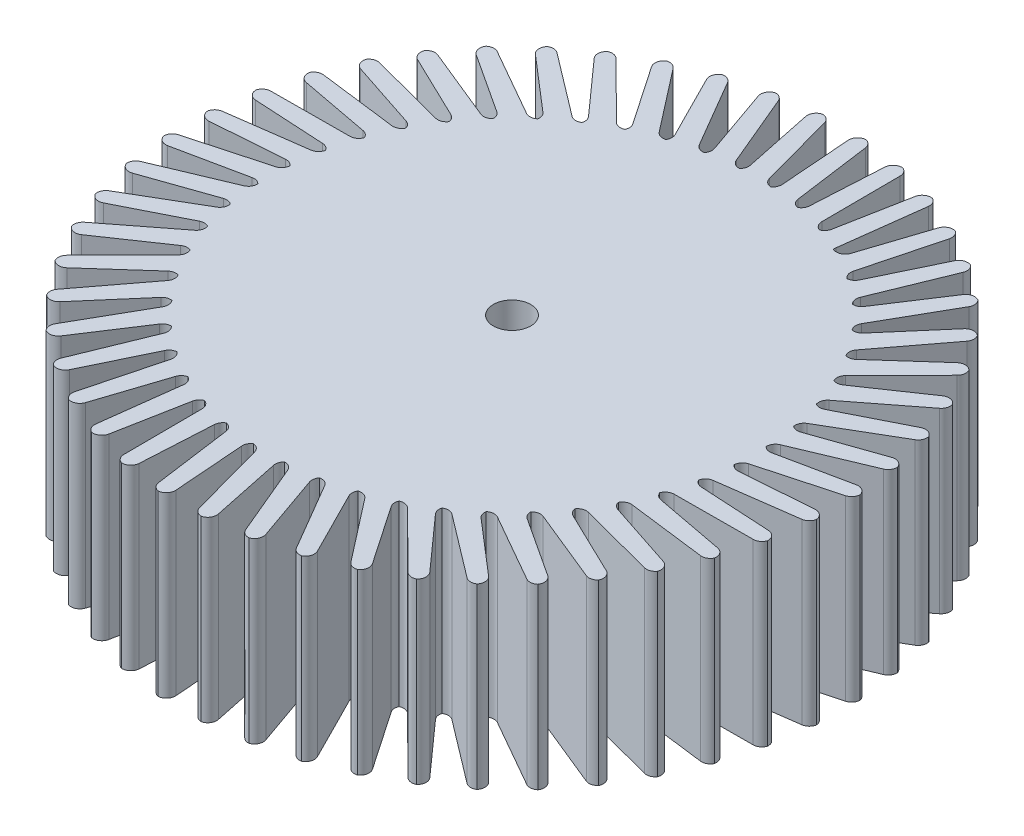
from build123d import *

# Parameters (mm, degrees)
SKETCH1_R           = 13.55
BOSS_EXTRUDE1_DEPTH = 10
SKETCH2_W           = 1
SKETCH2_H           = 8
BOSS_EXTRUDE2_DEPTH = 10
FILLET1_R           = 0.5
CIRPATTERN1_DEPTH   = 10


# Read off the part's stored shape, not the designer's step: CirPattern1
with BuildPart() as part:
    # Sketch1 → Boss-Extrude1 (new body)
    with BuildSketch(Plane(origin=(0, 0, 0), x_dir=(1, 0, 0), z_dir=(0, 1, 0))):
        with Locations(Location((0, 0, 0), (0, 0, 270))):
            Circle(SKETCH1_R)
    extrude(amount=BOSS_EXTRUDE1_DEPTH)

    # Sketch2 → Cut-Revolve1 (revolve, cut)
    with BuildSketch(Plane(origin=(0, 0, 0), x_dir=(0, 0, -1), z_dir=(1, 0, 0))):
        Polygon((0, 10), (0, 0), (0.05, 0), (0.05, 1), (0.05, 9), (0.05, 10), align=None)
        with BuildLine():
            ThreePointArc((1.05, 1), (0.757106781, 0.292893219), (0.05, 0))
            Line((0.05, 0), (1.05, 0))
            Line((1.05, 0), (1.05, 1))
        make_face()
        with BuildLine():
            Line((0.05, 1), (0.05, 0))
            ThreePointArc((0.05, 0), (0.757106781, 0.292893219), (1.05, 1))
            Line((1.05, 1), (0.05, 1))
        make_face()
        with BuildLine():
            ThreePointArc((1.05, 9), (0.757106781, 9.707106781), (0.05, 10))
            Line((0.05, 10), (0.05, 9))
            Line((0.05, 9), (1.05, 9))
        make_face()
        with BuildLine():
            Line((1.05, 10), (0.05, 10))
            ThreePointArc((0.05, 10), (0.757106781, 9.707106781), (1.05, 9))
            Line((1.05, 9), (1.05, 10))
        make_face()
        with Locations((0.55, 5)):
            Rectangle(SKETCH2_W, SKETCH2_H)
    revolve(axis=Axis((0, 0, 0), (0, 1, 0)), mode=Mode.SUBTRACT)

    # Sketch1<3> → Boss-Extrude2 (add)
    with BuildSketch(Plane(origin=(0, 0, 0), x_dir=(1, 0, 0), z_dir=(0, 1, 0))):
        with BuildLine():
            Line((8.666611372, 16.40098617), (6.330597525, 11.98023518))
            ThreePointArc((6.330597525, 11.98023518), (6.847142718, 11.692695865), (7.350653985, 11.382898839))
            Line((7.350653985, 11.382898839), (8.666611372, 16.40098617))
        make_face()
        Polygon((8.666611372, 16.40098617), (7.909290512, 16.779209591), (6.330597525, 11.98023518), align=None)
    extrude(amount=BOSS_EXTRUDE2_DEPTH)

    # Fillet1
    # the kernel refuses this fillet: 0.5 mm, written as the material it adds along each edge
    with BuildSketch(Plane(origin=(6.330597525, 0, -11.98023518), x_dir=(-0.8937672778939515, 0, -0.4485309944318632), z_dir=(0, 1, 0))) as fillet1_piece_1:
        with BuildLine():
            CenterArc((0.579649126, -0.499889719), FILLET1_R, 91.203401829, 97.236692762)
            Line((0.085064194, -0.573277353), (0, 0))
            ThreePointArc((0, 0), (0.284574118, -0.002988611), (0.569148236, 0))
        make_face()
    extrude(amount=10)
    with BuildSketch(Plane(origin=(7.350653985, 0, -11.382898839), x_dir=(0.8329727596859959, 0, 0.5533139991190319), z_dir=(0, 1, 0))) as fillet1_piece_2:
        with BuildLine():
            CenterArc((0.357318649, 0.499958096), FILLET1_R, 198.900147824, 70.358061506)
            Line((-0.115723612, 0.337998167), (0, 0))
            ThreePointArc((0, 0), (0.175422743, 0.001135588), (0.350845485, 0))
        make_face()
    extrude(amount=10)
    # the kernel refuses this fillet: 0.5 mm, written as the material it takes off along each edge
    with BuildSketch(Plane(origin=(7.909290512, -1.4463318, -16.779209591), x_dir=(0.8946335931706342, 0, 0.4468005527868112), z_dir=(0, 1, 0))) as fillet1_2_piece_1:
        with BuildLine():
            CenterArc((FILLET1_R * 1.15706544001, -FILLET1_R), FILLET1_R, 90, 98.329216797)
            Line((FILLET1_R * 0.167613391044, -FILLET1_R * 1.1448607704), (0, 0))
            Line((0, 0), (FILLET1_R * 1.15706544001, 0))
        make_face()
    extrude(amount=12.8926636, mode=Mode.SUBTRACT)
    with BuildSketch(Plane(origin=(8.666611372, -1.015049333, -16.40098617), x_dir=(-0.2536653920263894, 0, 0.967292028752485), z_dir=(0, 1, 0))) as fillet1_2_piece_2:
        with BuildLine():
            CenterArc((FILLET1_R * 0.812039466289, -FILLET1_R), FILLET1_R, 90, 78.155922469)
            Line((-FILLET1_R * 0.166670314419, -FILLET1_R * 0.794750967979), (0, 0))
            Line((0, 0), (FILLET1_R * 0.812039466289, 0))
        make_face()
    extrude(amount=12.030098666, mode=Mode.SUBTRACT)

    # CirPattern1 outline → CirPattern1 (add)
    with BuildSketch(Plane(origin=(0, 0, 0), x_dir=(1, 0, 0), z_dir=(0, 1, 0))):
        with BuildLine():
            ThreePointArc((9.03794035, 10.095451166), (8.884228267, 10.355633201), (8.908490317, 10.656853136))
            Line((8.908490317, 10.656853136), (10.579850738, 14.753517273))
            ThreePointArc((10.579850738, 14.753517273), (10.604246197, 15.05415706), (10.451286802, 15.314124064))
            ThreePointArc((10.451286802, 15.314124064), (10.067730955, 15.337620789), (9.780780476, 15.082030087))
            Line((9.780780476, 15.082030087), (8.041287678, 11.469144544))
            ThreePointArc((8.041287678, 11.469144544), (7.878548966, 11.277157004), (7.642898718, 11.188771121))
            ThreePointArc((7.642898718, 11.188771121), (8.358315329, 10.664945611), (9.03794035, 10.095451166))
        make_face()
        with BuildLine():
            ThreePointArc((4.798854406, 13.159581319), (4.691350912, 12.932015718), (4.486606202, 12.785650738))
            ThreePointArc((4.486606202, 12.785650738), (5.161593376, 12.528385922), (5.821911455, 12.235515805))
            ThreePointArc((5.821911455, 12.235515805), (5.815229867, 12.307746604), (5.819070114, 12.380184056))
            Line((5.819070114, 12.380184056), (6.400859814, 16.989070228))
            ThreePointArc((6.400859814, 16.989070228), (6.346612715, 17.285779971), (6.131580873, 17.49730001))
            ThreePointArc((6.131580873, 17.49730001), (5.755012974, 17.420724546), (5.543991837, 17.099574637))
            Line((5.543991837, 17.099574637), (4.798854406, 13.159581319))
        make_face()
        with BuildLine():
            ThreePointArc((3.0401295, 13.673375469), (2.963248986, 13.433724701), (2.779360358, 13.261887347))
            ThreePointArc((2.779360358, 13.261887347), (3.640778466, 13.051713763), (4.486606202, 12.785650738))
            ThreePointArc((4.486606202, 12.785650738), (4.2450274, 12.967204528), (4.152170733, 13.254780145))
            Line((4.152170733, 13.254780145), (4.128580925, 17.679206235))
            ThreePointArc((4.128580925, 17.679206235), (4.036069524, 17.966296918), (3.795268404, 18.147940087))
            ThreePointArc((3.795268404, 18.147940087), (3.4319172, 18.022867762), (3.264619853, 17.676921549))
            Line((3.264619853, 17.676921549), (3.0401295, 13.673375469))
        make_face()
        with BuildLine():
            ThreePointArc((1.229387136, 13.953214374), (1.184445047, 13.705578931), (1.024558888, 13.511209387))
            ThreePointArc((1.024558888, 13.511209387), (1.906040602, 13.415271492), (2.779360358, 13.261887347))
            ThreePointArc((2.779360358, 13.261887347), (2.516150771, 13.410355558), (2.386552355, 13.683350699))
            Line((2.386552355, 13.683350699), (1.785660871, 18.066846122))
            ThreePointArc((1.785660871, 18.066846122), (1.656468065, 18.339405544), (1.394017841, 18.488063877))
            ThreePointArc((1.394017841, 18.488063877), (1.050100371, 18.316634714), (0.929389317, 17.951811433))
            Line((0.929389317, 17.951811433), (1.229387136, 13.953214374))
        make_face()
        with BuildLine():
            ThreePointArc((-0.602390383, 13.994309912), (-0.614625075, 13.742926905), (-0.747773069, 13.529350887))
            ThreePointArc((-0.747773069, 13.529350887), (0.138689855, 13.549290207), (1.024558888, 13.511209386))
            ThreePointArc((1.024558888, 13.511209386), (0.744222106, 13.624051687), (0.580099406, 13.877795328))
            Line((0.580099406, 13.877795328), (-0.587812335, 18.145357263))
            ThreePointArc((-0.587812335, 18.145357263), (-0.751476023, 18.398721856), (-1.031084754, 18.511851768))
            ThreePointArc((-1.031084754, 18.511851768), (-1.349683967, 18.296998968), (-1.421743327, 17.919540847))
            Line((-1.421743327, 17.919540847), (-0.602390383, 13.994309912))
        make_face()
        with BuildLine():
            ThreePointArc((-2.423860835, 13.795958928), (-2.403178791, 13.54512959), (-2.507310422, 13.316001444))
            ThreePointArc((-2.507310422, 13.316001444), (-1.631033914, 13.451476809), (-0.747773069, 13.529350887))
            ThreePointArc((-0.747773069, 13.529350887), (-1.040440407, 13.604636513), (-1.236279206, 13.834787032))
            Line((-1.236279206, 13.834787032), (-2.951227909, 17.913396311))
            ThreePointArc((-2.951227909, 17.913396311), (-3.146562147, 18.143230937), (-3.438545203, 18.218896743))
            ThreePointArc((-3.438545203, 18.218896743), (-3.726374838, 17.964296496), (-3.748549549, 17.580661948))
            Line((-3.748549549, 17.580661948), (-2.423860835, 13.795958928))
        make_face()
        with BuildLine():
            ThreePointArc((-4.203858356, 13.361555262), (-4.150613451, 13.115571352), (-4.223946997, 12.874811523))
            ThreePointArc((-4.223946997, 12.874811523), (-3.372850241, 13.123504914), (-2.507310422, 13.316001443))
            ThreePointArc((-2.507310422, 13.316001443), (-2.807300696, 13.352442237), (-3.031504737, 13.555061694))
            Line((-3.031504737, 13.555061694), (-5.264147155, 17.374932181))
            ThreePointArc((-5.264147155, 17.374932181), (-5.48780972, 17.577304305), (-5.787171191, 17.614211344))
            ThreePointArc((-5.787171191, 17.614211344), (-6.039306402, 17.324219931), (-6.011217048, 16.940973049))
            Line((-6.011217048, 16.940973049), (-4.203858356, 13.361555262))
        make_face()
        with BuildLine():
            ThreePointArc((-5.911926696, 12.69853168), (-5.827029965, 12.461602051), (-5.868310669, 12.213330008))
            ThreePointArc((-5.868310669, 12.213330008), (-5.056956164, 12.570986211), (-4.223946997, 12.874811522))
            ThreePointArc((-4.223946997, 12.874811522), (-4.526127291, 12.871783973), (-4.774860382, 13.043405492))
            Line((-4.774860382, 13.043405492), (-7.486995384, 16.539178144))
            ThreePointArc((-7.486995384, 16.539178144), (-7.735159348, 16.710625124), (-8.036777075, 16.708141904))
            ThreePointArc((-8.036777075, 16.708141904), (-8.248903759, 16.387721159), (-8.171030958, 16.011419404))
            Line((-8.171030958, 16.011419404), (-5.911926696, 12.69853168))
        make_face()
        with BuildLine():
            ThreePointArc((-7.51884033, 11.818232701), (-7.403744381, 11.594411285), (-7.412265918, 11.342875031))
            ThreePointArc((-7.412265918, 11.342875031), (-6.654536166, 11.803374449), (-5.868310669, 12.213330007))
            ThreePointArc((-5.868310669, 12.213330007), (-6.167510594, 12.170885916), (-6.436516842, 12.308573006))
            Line((-6.436516842, 12.308573006), (-9.581739046, 15.420434183))
            ThreePointArc((-9.581739046, 15.420434183), (-9.850158254, 15.558022514), (-10.148871475, 15.516191525))
            ThreePointArc((-10.148871475, 15.516191525), (-10.317360086, 15.170823935), (-10.191036262, 14.807905934))
            Line((-10.191036262, 14.807905934), (-7.51884033, 11.818232701))
        make_face()
        with BuildLine():
            ThreePointArc((-8.997104522, 10.735720484), (-8.853778677, 10.528836927), (-8.829395242, 10.278340316))
            ThreePointArc((-8.829395242, 10.278340316), (-8.138255208, 10.833803678), (-7.412265917, 11.34287503))
            ThreePointArc((-7.412265917, 11.34287503), (-7.70336608, 11.261740626), (-7.988042714, 11.363137423))
            Line((-7.988042714, 11.363137423), (-11.512536497, 14.037842318))
            ThreePointArc((-11.512536497, 14.037842318), (-11.796618222, 14.139217825), (-12.08731587, 14.058754807))
            ThreePointArc((-12.08731587, 14.058754807), (-12.209283522, 13.694349708), (-12.036670111, 13.351025088))
            Line((-12.036670111, 13.351025088), (-8.997104522, 10.735720484))
        make_face()
        with BuildLine():
            ThreePointArc((-10.321425761, 9.469517113), (-10.152322366, 9.28311125), (-10.095451166, 9.03794035))
            ThreePointArc((-10.095451166, 9.03794035), (-9.482726448, 9.678863522), (-8.829395241, 10.278340315))
            ThreePointArc((-8.829395241, 10.278340315), (-9.107414837, 10.159903832), (-9.402890961, 10.223275408))
            Line((-9.402890961, 10.223275408), (-13.246351256, 12.41505908))
            ThreePointArc((-13.246351256, 12.41505908), (-13.541234781, 12.478487198), (-13.818942939, 12.360768896))
            ThreePointArc((-13.818942939, 12.360768896), (-13.892302731, 11.98356136), (-13.676353196, 11.665704501))
            Line((-13.676353196, 11.665704501), (-10.321425761, 9.469517113))
        make_face()
        with BuildLine():
            ThreePointArc((-11.469144544, 8.041287678), (-11.277157004, 7.878548966), (-11.188771121, 7.642898718))
            ThreePointArc((-11.188771121, 7.642898718), (-10.664945609, 8.358315327), (-10.095451164, 9.037940349))
            ThreePointArc((-10.095451164, 9.037940349), (-10.355633201, 8.884228267), (-10.656853136, 8.908490317))
            Line((-10.656853136, 8.908490317), (-14.753517273, 10.579850738))
            ThreePointArc((-14.753517273, 10.579850738), (-15.05415706, 10.604246197), (-15.314124064, 10.451286802))
            ThreePointArc((-15.314124064, 10.451286802), (-15.337620789, 10.067730955), (-15.082030087, 9.780780476))
            Line((-15.082030087, 9.780780476), (-11.469144544, 8.041287678))
        make_face()
        with BuildLine():
            ThreePointArc((-12.420623084, 6.475469582), (-12.20903636, 6.339182524), (-12.0906481, 6.117084969))
            ThreePointArc((-12.0906481, 6.117084969), (-11.664684594, 6.89475404), (-11.188771119, 7.642898717))
            ThreePointArc((-11.188771119, 7.642898717), (-11.426663811, 7.456541093), (-11.7284736, 7.441278486))
            Line((-11.7284736, 7.441278486), (-16.008246518, 8.563618217))
            ThreePointArc((-16.008246518, 8.563618217), (-16.309498536, 8.548563602), (-16.547276279, 8.362980293))
            ThreePointArc((-16.547276279, 8.362980293), (-16.520507902, 7.979638881), (-16.229649261, 7.728504585))
            Line((-16.229649261, 7.728504585), (-12.420623084, 6.475469582))
        make_face()
        with BuildLine():
            ThreePointArc((-13.159581319, 4.798854406), (-12.932015718, 4.691350912), (-12.785650738, 4.486606202))
            ThreePointArc((-12.785650738, 4.486606202), (-12.464837592, 5.3132216), (-12.090648099, 6.117084968))
            ThreePointArc((-12.090648099, 6.117084968), (-12.302181033, 5.901270433), (-12.599416628, 5.846744318))
            Line((-12.599416628, 5.846744318), (-16.989070228, 6.400859814))
            ThreePointArc((-16.989070228, 6.400859814), (-17.285779971, 6.346612715), (-17.49730001, 6.131580873))
            ThreePointArc((-17.49730001, 6.131580873), (-17.420724546, 5.755012974), (-17.099574637, 5.543991837))
            Line((-17.099574637, 5.543991837), (-13.159581319, 4.798854406))
        make_face()
        with BuildLine():
            ThreePointArc((-13.673375469, 3.0401295), (-13.433724701, 2.963248986), (-13.261887347, 2.779360358))
            ThreePointArc((-13.261887347, 2.779360358), (-13.051713762, 3.640778466), (-12.785650736, 4.486606201))
            ThreePointArc((-12.785650736, 4.486606201), (-12.967204528, 4.2450274), (-13.254780145, 4.152170733))
            Line((-13.254780145, 4.152170733), (-17.679206235, 4.128580925))
            ThreePointArc((-17.679206235, 4.128580925), (-17.966296918, 4.036069524), (-18.147940087, 3.795268404))
            ThreePointArc((-18.147940087, 3.795268404), (-18.022867762, 3.4319172), (-17.676921549, 3.264619853))
            Line((-17.676921549, 3.264619853), (-13.673375469, 3.0401295))
        make_face()
        with BuildLine():
            ThreePointArc((-13.953214374, 1.229387136), (-13.705578931, 1.184445047), (-13.511209387, 1.024558888))
            ThreePointArc((-13.511209387, 1.024558888), (-13.415271491, 1.906040602), (-13.261887345, 2.779360358))
            ThreePointArc((-13.261887345, 2.779360358), (-13.410355558, 2.516150771), (-13.683350699, 2.386552355))
            Line((-13.683350699, 2.386552355), (-18.066846122, 1.785660871))
            ThreePointArc((-18.066846122, 1.785660871), (-18.339405544, 1.656468065), (-18.488063877, 1.394017841))
            ThreePointArc((-18.488063877, 1.394017841), (-18.316634714, 1.050100371), (-17.951811433, 0.929389317))
            Line((-17.951811433, 0.929389317), (-13.953214374, 1.229387136))
        make_face()
        with BuildLine():
            ThreePointArc((-13.994309912, -0.602390383), (-13.742926905, -0.614625075), (-13.529350887, -0.747773069))
            ThreePointArc((-13.529350887, -0.747773069), (-13.549290206, 0.138689855), (-13.511209385, 1.024558888))
            ThreePointArc((-13.511209385, 1.024558888), (-13.624051687, 0.744222106), (-13.877795328, 0.580099406))
            Line((-13.877795328, 0.580099406), (-18.145357263, -0.587812335))
            ThreePointArc((-18.145357263, -0.587812335), (-18.398721856, -0.751476023), (-18.511851768, -1.031084754))
            ThreePointArc((-18.511851768, -1.031084754), (-18.296998968, -1.349683967), (-17.919540847, -1.421743327))
            Line((-17.919540847, -1.421743327), (-13.994309912, -0.602390383))
        make_face()
        with BuildLine():
            ThreePointArc((-13.795958928, -2.423860835), (-13.54512959, -2.403178791), (-13.316001444, -2.507310422))
            ThreePointArc((-13.316001444, -2.507310422), (-13.451476809, -1.631033914), (-13.529350886, -0.747773069))
            ThreePointArc((-13.529350886, -0.747773069), (-13.604636513, -1.040440407), (-13.834787032, -1.236279206))
            Line((-13.834787032, -1.236279206), (-17.913396311, -2.951227909))
            ThreePointArc((-17.913396311, -2.951227909), (-18.143230937, -3.146562147), (-18.218896743, -3.438545203))
            ThreePointArc((-18.218896743, -3.438545203), (-17.964296496, -3.726374838), (-17.580661948, -3.748549549))
            Line((-17.580661948, -3.748549549), (-13.795958928, -2.423860835))
        make_face()
        with BuildLine():
            ThreePointArc((-13.361555262, -4.203858356), (-13.115571352, -4.150613451), (-12.874811523, -4.223946997))
            ThreePointArc((-12.874811523, -4.223946997), (-13.123504914, -3.37285024), (-13.316001442, -2.507310422))
            ThreePointArc((-13.316001442, -2.507310422), (-13.352442237, -2.807300696), (-13.555061694, -3.031504737))
            Line((-13.555061694, -3.031504737), (-17.374932181, -5.264147155))
            ThreePointArc((-17.374932181, -5.264147155), (-17.577304305, -5.48780972), (-17.614211344, -5.787171191))
            ThreePointArc((-17.614211344, -5.787171191), (-17.324219931, -6.039306402), (-16.940973049, -6.011217048))
            Line((-16.940973049, -6.011217048), (-13.361555262, -4.203858356))
        make_face()
        with BuildLine():
            ThreePointArc((-12.69853168, -5.911926696), (-12.461602051, -5.827029965), (-12.213330008, -5.868310669))
            ThreePointArc((-12.213330008, -5.868310669), (-12.570986211, -5.056956164), (-12.874811522, -4.223946997))
            ThreePointArc((-12.874811522, -4.223946997), (-12.871783973, -4.526127291), (-13.043405492, -4.774860382))
            Line((-13.043405492, -4.774860382), (-16.539178144, -7.486995384))
            ThreePointArc((-16.539178144, -7.486995384), (-16.710625124, -7.735159348), (-16.708141904, -8.036777075))
            ThreePointArc((-16.708141904, -8.036777075), (-16.387721159, -8.248903759), (-16.011419404, -8.171030958))
            Line((-16.011419404, -8.171030958), (-12.69853168, -5.911926696))
        make_face()
        with BuildLine():
            ThreePointArc((-11.818232701, -7.51884033), (-11.594411285, -7.403744381), (-11.342875031, -7.412265918))
            ThreePointArc((-11.342875031, -7.412265918), (-11.803374449, -6.654536166), (-12.213330007, -5.868310669))
            ThreePointArc((-12.213330007, -5.868310669), (-12.170885916, -6.167510594), (-12.308573006, -6.436516842))
            Line((-12.308573006, -6.436516842), (-15.420434183, -9.581739046))
            ThreePointArc((-15.420434183, -9.581739046), (-15.558022514, -9.850158254), (-15.516191525, -10.148871475))
            ThreePointArc((-15.516191525, -10.148871475), (-15.170823935, -10.317360086), (-14.807905934, -10.191036262))
            Line((-14.807905934, -10.191036262), (-11.818232701, -7.51884033))
        make_face()
        with BuildLine():
            ThreePointArc((-10.735720484, -8.997104522), (-10.528836927, -8.853778677), (-10.278340316, -8.829395242))
            ThreePointArc((-10.278340316, -8.829395242), (-10.833803678, -8.138255209), (-11.34287503, -7.412265917))
            ThreePointArc((-11.34287503, -7.412265917), (-11.261740626, -7.70336608), (-11.363137423, -7.988042714))
            Line((-11.363137423, -7.988042714), (-14.037842318, -11.512536497))
            ThreePointArc((-14.037842318, -11.512536497), (-14.139217825, -11.796618222), (-14.058754807, -12.08731587))
            ThreePointArc((-14.058754807, -12.08731587), (-13.694349708, -12.209283522), (-13.351025088, -12.036670111))
            Line((-13.351025088, -12.036670111), (-10.735720484, -8.997104522))
        make_face()
        with BuildLine():
            ThreePointArc((-9.469517113, -10.321425761), (-9.28311125, -10.152322366), (-9.03794035, -10.095451166))
            ThreePointArc((-9.03794035, -10.095451166), (-9.678863522, -9.482726449), (-10.278340316, -8.829395242))
            ThreePointArc((-10.278340316, -8.829395242), (-10.159903832, -9.107414837), (-10.223275408, -9.402890961))
            Line((-10.223275408, -9.402890961), (-12.41505908, -13.246351256))
            ThreePointArc((-12.41505908, -13.246351256), (-12.478487198, -13.541234781), (-12.360768896, -13.818942939))
            ThreePointArc((-12.360768896, -13.818942939), (-11.98356136, -13.892302731), (-11.665704501, -13.676353196))
            Line((-11.665704501, -13.676353196), (-9.469517113, -10.321425761))
        make_face()
        with BuildLine():
            ThreePointArc((-8.041287678, -11.469144544), (-7.878548966, -11.277157004), (-7.642898718, -11.188771121))
            ThreePointArc((-7.642898718, -11.188771121), (-8.358315328, -10.66494561), (-9.037940349, -10.095451165))
            ThreePointArc((-9.037940349, -10.095451165), (-8.884228267, -10.355633201), (-8.908490317, -10.656853136))
            Line((-8.908490317, -10.656853136), (-10.579850738, -14.753517273))
            ThreePointArc((-10.579850738, -14.753517273), (-10.604246197, -15.05415706), (-10.451286802, -15.314124064))
            ThreePointArc((-10.451286802, -15.314124064), (-10.067730955, -15.337620789), (-9.780780476, -15.082030087))
            Line((-9.780780476, -15.082030087), (-8.041287678, -11.469144544))
        make_face()
        with BuildLine():
            ThreePointArc((-6.475469582, -12.420623084), (-6.339182524, -12.20903636), (-6.117084969, -12.0906481))
            ThreePointArc((-6.117084969, -12.0906481), (-6.894754041, -11.664684595), (-7.642898718, -11.18877112))
            ThreePointArc((-7.642898718, -11.18877112), (-7.456541093, -11.426663811), (-7.441278486, -11.7284736))
            Line((-7.441278486, -11.7284736), (-8.563618217, -16.008246518))
            ThreePointArc((-8.563618217, -16.008246518), (-8.548563602, -16.309498536), (-8.362980293, -16.547276279))
            ThreePointArc((-8.362980293, -16.547276279), (-7.979638881, -16.520507902), (-7.728504585, -16.229649261))
            Line((-7.728504585, -16.229649261), (-6.475469582, -12.420623084))
        make_face()
        with BuildLine():
            ThreePointArc((-4.798854406, -13.159581319), (-4.691350912, -12.932015718), (-4.486606202, -12.785650738))
            ThreePointArc((-4.486606202, -12.785650738), (-5.313221601, -12.464837593), (-6.117084969, -12.0906481))
            ThreePointArc((-6.117084969, -12.0906481), (-5.901270433, -12.302181033), (-5.846744318, -12.599416628))
            Line((-5.846744318, -12.599416628), (-6.400859814, -16.989070228))
            ThreePointArc((-6.400859814, -16.989070228), (-6.346612715, -17.285779971), (-6.131580873, -17.49730001))
            ThreePointArc((-6.131580873, -17.49730001), (-5.755012974, -17.420724546), (-5.543991837, -17.099574637))
            Line((-5.543991837, -17.099574637), (-4.798854406, -13.159581319))
        make_face()
        with BuildLine():
            ThreePointArc((-3.0401295, -13.673375469), (-2.963248986, -13.433724701), (-2.779360358, -13.261887347))
            ThreePointArc((-2.779360358, -13.261887347), (-3.640778466, -13.051713764), (-4.486606202, -12.785650738))
            ThreePointArc((-4.486606202, -12.785650738), (-4.2450274, -12.967204528), (-4.152170733, -13.254780145))
            Line((-4.152170733, -13.254780145), (-4.128580925, -17.679206235))
            ThreePointArc((-4.128580925, -17.679206235), (-4.036069524, -17.966296918), (-3.795268404, -18.147940087))
            ThreePointArc((-3.795268404, -18.147940087), (-3.4319172, -18.022867762), (-3.264619853, -17.676921549))
            Line((-3.264619853, -17.676921549), (-3.0401295, -13.673375469))
        make_face()
        with BuildLine():
            ThreePointArc((-1.229387136, -13.953214374), (-1.184445047, -13.705578931), (-1.024558888, -13.511209387))
            ThreePointArc((-1.024558888, -13.511209387), (-1.906040602, -13.415271493), (-2.779360358, -13.261887347))
            ThreePointArc((-2.779360358, -13.261887347), (-2.516150771, -13.410355558), (-2.386552355, -13.683350699))
            Line((-2.386552355, -13.683350699), (-1.785660871, -18.066846122))
            ThreePointArc((-1.785660871, -18.066846122), (-1.656468065, -18.339405544), (-1.394017841, -18.488063877))
            ThreePointArc((-1.394017841, -18.488063877), (-1.050100371, -18.316634714), (-0.929389317, -17.951811433))
            Line((-0.929389317, -17.951811433), (-1.229387136, -13.953214374))
        make_face()
        with BuildLine():
            ThreePointArc((0.602390383, -13.994309912), (0.614625075, -13.742926905), (0.747773069, -13.529350887))
            ThreePointArc((0.747773069, -13.529350887), (-0.138689855, -13.549290208), (-1.024558888, -13.511209387))
            ThreePointArc((-1.024558888, -13.511209387), (-0.744222106, -13.624051687), (-0.580099406, -13.877795328))
            Line((-0.580099406, -13.877795328), (0.587812335, -18.145357263))
            ThreePointArc((0.587812335, -18.145357263), (0.751476023, -18.398721856), (1.031084754, -18.511851768))
            ThreePointArc((1.031084754, -18.511851768), (1.349683967, -18.296998968), (1.421743327, -17.919540847))
            Line((1.421743327, -17.919540847), (0.602390383, -13.994309912))
        make_face()
        with BuildLine():
            ThreePointArc((2.423860835, -13.795958928), (2.403178791, -13.54512959), (2.507310422, -13.316001444))
            ThreePointArc((2.507310422, -13.316001444), (1.631033914, -13.451476811), (0.747773069, -13.529350888))
            ThreePointArc((0.747773069, -13.529350888), (1.040440407, -13.604636513), (1.236279206, -13.834787032))
            Line((1.236279206, -13.834787032), (2.951227909, -17.913396311))
            ThreePointArc((2.951227909, -17.913396311), (3.146562147, -18.143230937), (3.438545203, -18.218896743))
            ThreePointArc((3.438545203, -18.218896743), (3.726374838, -17.964296496), (3.748549549, -17.580661948))
            Line((3.748549549, -17.580661948), (2.423860835, -13.795958928))
        make_face()
        with BuildLine():
            ThreePointArc((4.203858356, -13.361555262), (4.150613451, -13.115571352), (4.223946997, -12.874811523))
            ThreePointArc((4.223946997, -12.874811523), (3.372850241, -13.123504916), (2.507310422, -13.316001445))
            ThreePointArc((2.507310422, -13.316001445), (2.807300696, -13.352442237), (3.031504737, -13.555061694))
            Line((3.031504737, -13.555061694), (5.264147155, -17.374932181))
            ThreePointArc((5.264147155, -17.374932181), (5.48780972, -17.577304305), (5.787171191, -17.614211344))
            ThreePointArc((5.787171191, -17.614211344), (6.039306402, -17.324219931), (6.011217048, -16.940973049))
            Line((6.011217048, -16.940973049), (4.203858356, -13.361555262))
        make_face()
        with BuildLine():
            ThreePointArc((5.911926696, -12.69853168), (5.827029965, -12.461602051), (5.868310669, -12.213330008))
            ThreePointArc((5.868310669, -12.213330008), (5.056956165, -12.570986214), (4.223946998, -12.874811525))
            ThreePointArc((4.223946998, -12.874811525), (4.526127291, -12.871783973), (4.774860382, -13.043405492))
            Line((4.774860382, -13.043405492), (7.486995384, -16.539178144))
            ThreePointArc((7.486995384, -16.539178144), (7.735159348, -16.710625124), (8.036777075, -16.708141904))
            ThreePointArc((8.036777075, -16.708141904), (8.248903759, -16.387721159), (8.171030958, -16.011419404))
            Line((8.171030958, -16.011419404), (5.911926696, -12.69853168))
        make_face()
        with BuildLine():
            ThreePointArc((7.51884033, -11.818232701), (7.403744381, -11.594411285), (7.412265918, -11.342875031))
            ThreePointArc((7.412265918, -11.342875031), (6.654536167, -11.803374452), (5.86831067, -12.21333001))
            ThreePointArc((5.86831067, -12.21333001), (6.167510594, -12.170885916), (6.436516842, -12.308573006))
            Line((6.436516842, -12.308573006), (9.581739046, -15.420434183))
            ThreePointArc((9.581739046, -15.420434183), (9.850158254, -15.558022514), (10.148871475, -15.516191525))
            ThreePointArc((10.148871475, -15.516191525), (10.317360086, -15.170823935), (10.191036262, -14.807905934))
            Line((10.191036262, -14.807905934), (7.51884033, -11.818232701))
        make_face()
        with BuildLine():
            ThreePointArc((8.997104522, -10.735720484), (8.853778677, -10.528836927), (8.829395242, -10.278340316))
            ThreePointArc((8.829395242, -10.278340316), (8.13825521, -10.83380368), (7.412265919, -11.342875032))
            ThreePointArc((7.412265919, -11.342875032), (7.70336608, -11.261740626), (7.988042714, -11.363137423))
            Line((7.988042714, -11.363137423), (11.512536497, -14.037842318))
            ThreePointArc((11.512536497, -14.037842318), (11.796618222, -14.139217825), (12.08731587, -14.058754807))
            ThreePointArc((12.08731587, -14.058754807), (12.209283522, -13.694349708), (12.036670111, -13.351025088))
            Line((12.036670111, -13.351025088), (8.997104522, -10.735720484))
        make_face()
        with BuildLine():
            ThreePointArc((10.321425761, -9.469517113), (10.152322366, -9.28311125), (10.095451166, -9.03794035))
            ThreePointArc((10.095451166, -9.03794035), (9.48272645, -9.678863524), (8.829395243, -10.278340318))
            ThreePointArc((8.829395243, -10.278340318), (9.107414837, -10.159903832), (9.402890961, -10.223275408))
            Line((9.402890961, -10.223275408), (13.246351256, -12.41505908))
            ThreePointArc((13.246351256, -12.41505908), (13.541234781, -12.478487198), (13.818942939, -12.360768896))
            ThreePointArc((13.818942939, -12.360768896), (13.892302731, -11.98356136), (13.676353196, -11.665704501))
            Line((13.676353196, -11.665704501), (10.321425761, -9.469517113))
        make_face()
        with BuildLine():
            ThreePointArc((11.469144544, -8.041287678), (11.277157004, -7.878548966), (11.188771121, -7.642898718))
            ThreePointArc((11.188771121, -7.642898718), (10.664945612, -8.35831533), (10.095451167, -9.037940351))
            ThreePointArc((10.095451167, -9.037940351), (10.355633201, -8.884228267), (10.656853136, -8.908490317))
            Line((10.656853136, -8.908490317), (14.753517273, -10.579850738))
            ThreePointArc((14.753517273, -10.579850738), (15.05415706, -10.604246197), (15.314124064, -10.451286802))
            ThreePointArc((15.314124064, -10.451286802), (15.337620789, -10.067730955), (15.082030087, -9.780780476))
            Line((15.082030087, -9.780780476), (11.469144544, -8.041287678))
        make_face()
        with BuildLine():
            ThreePointArc((12.420623084, -6.475469582), (12.20903636, -6.339182524), (12.0906481, -6.117084969))
            ThreePointArc((12.0906481, -6.117084969), (11.664684597, -6.894754042), (11.188771122, -7.642898719))
            ThreePointArc((11.188771122, -7.642898719), (11.426663811, -7.456541093), (11.7284736, -7.441278486))
            Line((11.7284736, -7.441278486), (16.008246518, -8.563618217))
            ThreePointArc((16.008246518, -8.563618217), (16.309498536, -8.548563602), (16.547276279, -8.362980293))
            ThreePointArc((16.547276279, -8.362980293), (16.520507902, -7.979638881), (16.229649261, -7.728504585))
            Line((16.229649261, -7.728504585), (12.420623084, -6.475469582))
        make_face()
        with BuildLine():
            ThreePointArc((13.159581319, -4.798854406), (12.932015718, -4.691350912), (12.785650738, -4.486606202))
            ThreePointArc((12.785650738, -4.486606202), (12.464837595, -5.313221602), (12.090648102, -6.11708497))
            ThreePointArc((12.090648102, -6.11708497), (12.302181033, -5.901270433), (12.599416628, -5.846744318))
            Line((12.599416628, -5.846744318), (16.989070228, -6.400859814))
            ThreePointArc((16.989070228, -6.400859814), (17.285779971, -6.346612715), (17.49730001, -6.131580873))
            ThreePointArc((17.49730001, -6.131580873), (17.420724546, -5.755012974), (17.099574637, -5.543991837))
            Line((17.099574637, -5.543991837), (13.159581319, -4.798854406))
        make_face()
        with BuildLine():
            ThreePointArc((13.673375469, -3.0401295), (13.433724701, -2.963248986), (13.261887347, -2.779360358))
            ThreePointArc((13.261887347, -2.779360358), (13.051713765, -3.640778467), (12.78565074, -4.486606203))
            ThreePointArc((12.78565074, -4.486606203), (12.967204528, -4.2450274), (13.254780145, -4.152170733))
            Line((13.254780145, -4.152170733), (17.679206235, -4.128580925))
            ThreePointArc((17.679206235, -4.128580925), (17.966296918, -4.036069524), (18.147940087, -3.795268404))
            ThreePointArc((18.147940087, -3.795268404), (18.022867762, -3.4319172), (17.676921549, -3.264619853))
            Line((17.676921549, -3.264619853), (13.673375469, -3.0401295))
        make_face()
        with BuildLine():
            ThreePointArc((13.953214374, -1.229387136), (13.705578931, -1.184445047), (13.511209387, -1.024558888))
            ThreePointArc((13.511209387, -1.024558888), (13.415271495, -1.906040602), (13.261887349, -2.779360358))
            ThreePointArc((13.261887349, -2.779360358), (13.410355558, -2.516150771), (13.683350699, -2.386552355))
            Line((13.683350699, -2.386552355), (18.066846122, -1.785660871))
            ThreePointArc((18.066846122, -1.785660871), (18.339405544, -1.656468065), (18.488063877, -1.394017841))
            ThreePointArc((18.488063877, -1.394017841), (18.316634714, -1.050100371), (17.951811433, -0.929389317))
            Line((17.951811433, -0.929389317), (13.953214374, -1.229387136))
        make_face()
        with BuildLine():
            ThreePointArc((13.994309912, 0.602390383), (13.742926905, 0.614625075), (13.529350887, 0.747773069))
            ThreePointArc((13.529350887, 0.747773069), (13.549290209, -0.138689855), (13.511209388, -1.024558888))
            ThreePointArc((13.511209388, -1.024558888), (13.624051687, -0.744222106), (13.877795328, -0.580099406))
            Line((13.877795328, -0.580099406), (18.145357263, 0.587812335))
            ThreePointArc((18.145357263, 0.587812335), (18.398721856, 0.751476023), (18.511851768, 1.031084754))
            ThreePointArc((18.511851768, 1.031084754), (18.296998968, 1.349683967), (17.919540847, 1.421743327))
            Line((17.919540847, 1.421743327), (13.994309912, 0.602390383))
        make_face()
        with BuildLine():
            ThreePointArc((13.795958928, 2.423860835), (13.54512959, 2.403178791), (13.316001444, 2.507310422))
            ThreePointArc((13.316001444, 2.507310422), (13.451476812, 1.631033914), (13.529350889, 0.747773069))
            ThreePointArc((13.529350889, 0.747773069), (13.604636513, 1.040440407), (13.834787032, 1.236279206))
            Line((13.834787032, 1.236279206), (17.913396311, 2.951227909))
            ThreePointArc((17.913396311, 2.951227909), (18.143230937, 3.146562147), (18.218896743, 3.438545203))
            ThreePointArc((18.218896743, 3.438545203), (17.964296496, 3.726374838), (17.580661948, 3.748549549))
            Line((17.580661948, 3.748549549), (13.795958928, 2.423860835))
        make_face()
        with BuildLine():
            ThreePointArc((13.361555262, 4.203858356), (13.115571352, 4.150613451), (12.874811523, 4.223946997))
            ThreePointArc((12.874811523, 4.223946997), (13.123504916, 3.372850241), (13.316001445, 2.507310422))
            ThreePointArc((13.316001445, 2.507310422), (13.352442237, 2.807300696), (13.555061694, 3.031504737))
            Line((13.555061694, 3.031504737), (17.374932181, 5.264147155))
            ThreePointArc((17.374932181, 5.264147155), (17.577304305, 5.48780972), (17.614211344, 5.787171191))
            ThreePointArc((17.614211344, 5.787171191), (17.324219931, 6.039306402), (16.940973049, 6.011217048))
            Line((16.940973049, 6.011217048), (13.361555262, 4.203858356))
        make_face()
        with BuildLine():
            ThreePointArc((12.69853168, 5.911926696), (12.461602051, 5.827029965), (12.213330008, 5.868310669))
            ThreePointArc((12.213330008, 5.868310669), (12.570986214, 5.056956165), (12.874811525, 4.223946998))
            ThreePointArc((12.874811525, 4.223946998), (12.871783973, 4.526127291), (13.043405492, 4.774860382))
            Line((13.043405492, 4.774860382), (16.539178144, 7.486995384))
            ThreePointArc((16.539178144, 7.486995384), (16.710625124, 7.735159348), (16.708141904, 8.036777075))
            ThreePointArc((16.708141904, 8.036777075), (16.387721159, 8.248903759), (16.011419404, 8.171030958))
            Line((16.011419404, 8.171030958), (12.69853168, 5.911926696))
        make_face()
        with BuildLine():
            ThreePointArc((11.818232701, 7.51884033), (11.594411285, 7.403744381), (11.342875031, 7.412265918))
            ThreePointArc((11.342875031, 7.412265918), (11.803374451, 6.654536167), (12.213330009, 5.86831067))
            ThreePointArc((12.213330009, 5.86831067), (12.170885916, 6.167510594), (12.308573006, 6.436516842))
            Line((12.308573006, 6.436516842), (15.420434183, 9.581739046))
            ThreePointArc((15.420434183, 9.581739046), (15.558022514, 9.850158254), (15.516191525, 10.148871475))
            ThreePointArc((15.516191525, 10.148871475), (15.170823935, 10.317360086), (14.807905934, 10.191036262))
            Line((14.807905934, 10.191036262), (11.818232701, 7.51884033))
        make_face()
        with BuildLine():
            ThreePointArc((10.735720484, 8.997104522), (10.528836927, 8.853778677), (10.278340316, 8.829395242))
            ThreePointArc((10.278340316, 8.829395242), (10.83380368, 8.13825521), (11.342875032, 7.412265918))
            ThreePointArc((11.342875032, 7.412265918), (11.261740626, 7.70336608), (11.363137423, 7.988042714))
            Line((11.363137423, 7.988042714), (14.037842318, 11.512536497))
            ThreePointArc((14.037842318, 11.512536497), (14.139217825, 11.796618222), (14.058754807, 12.08731587))
            ThreePointArc((14.058754807, 12.08731587), (13.694349708, 12.209283522), (13.351025088, 12.036670111))
            Line((13.351025088, 12.036670111), (10.735720484, 8.997104522))
        make_face()
        with BuildLine():
            ThreePointArc((9.469517113, 10.321425761), (9.28311125, 10.152322366), (9.03794035, 10.095451166))
            ThreePointArc((9.03794035, 10.095451166), (9.678863523, 9.48272645), (10.278340317, 8.829395243))
            ThreePointArc((10.278340317, 8.829395243), (10.159903832, 9.107414837), (10.223275408, 9.402890961))
            Line((10.223275408, 9.402890961), (12.41505908, 13.246351256))
            ThreePointArc((12.41505908, 13.246351256), (12.478487198, 13.541234781), (12.360768896, 13.818942939))
            ThreePointArc((12.360768896, 13.818942939), (11.98356136, 13.892302731), (11.665704501, 13.676353196))
            Line((11.665704501, 13.676353196), (9.469517113, 10.321425761))
        make_face()
    extrude(amount=CIRPATTERN1_DEPTH)


solid = part.part
